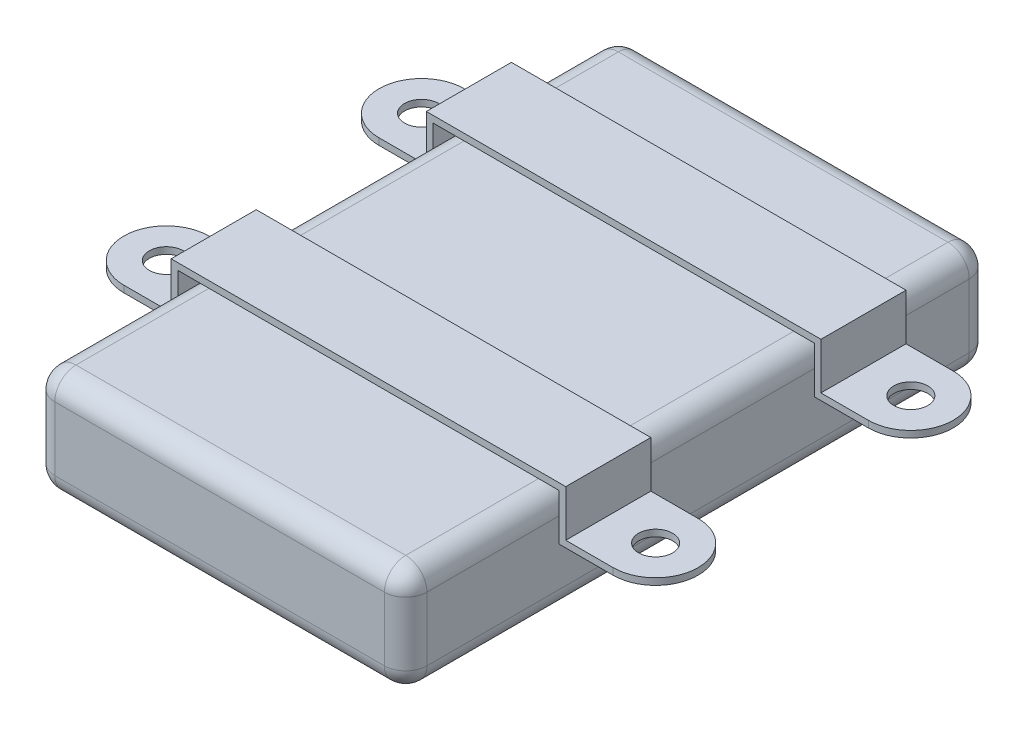
from build123d import *

# Parameters (mm, degrees)
SKETCH1_W      = 69.85
SKETCH1_H      = 12.7
EXTRUDE1_DEPTH = 22.225
FILLET1_R      = 2.54
EXTRUDE2_START = -27.94
EXTRUDE2_DEPTH = 10.16
EXTRUDE3_START = -58.42
EXTRUDE3_DEPTH = 10.16
SKETCH3_R      = 2.032
EXTRUDE4_DEPTH = 18.542


with BuildPart() as part:
    # Sketch1 → Extrude1 (new, symmetric)
    with BuildSketch(Plane(origin=(0, 0, 0), x_dir=(0, 0, -1), z_dir=(1, 0, 0))):
        with Locations((34.925, 6.35)):
            Rectangle(SKETCH1_W, SKETCH1_H)
    extrude(amount=EXTRUDE1_DEPTH, both=True)

    # Fillet1
    fillet1_edges = [part.edges().sort_by_distance(p)[0] for p in [
        (-22.225, 0, -34.925),
        (0, 0, -69.85),
        (-22.225, 6.35, -69.85),
        (22.225, 6.35, -69.85),
        (22.225, 0, -34.925),
        (22.225, 6.35, 0),
        (0, 0, 0),
        (-22.225, 6.35, 0),
        (0, 12.7, -69.85),
        (22.225, 12.7, -34.925),
        (0, 12.7, 0),
        (-22.225, 12.7, -34.925),
    ]]
    fillet(fillet1_edges, radius=FILLET1_R)


with BuildPart() as body_2:
    # Sketch2 → Extrude2 (new body)
    with BuildSketch(Plane.XY.offset(EXTRUDE2_START)):
        Polygon((-34.868909027, 7.784119326), (-22.771071042, 7.784119326), (-22.771071042, 13.333656019), (0, 13.333656019), (22.771071042, 13.333656019), (22.771071042, 7.784119326), (34.868909027, 7.784119326), (34.868909027, 8.577869326), (23.564821042, 8.577869326), (23.564821042, 14.127406019), (0, 14.127406019), (-23.564821042, 14.127406019), (-23.564821042, 8.577869326), (-34.868909027, 8.577869326), align=None)
    extrude(amount=EXTRUDE2_DEPTH)


with BuildPart() as body_3:
    # Sketch2<2> → Extrude3 (new body)
    with BuildSketch(Plane.XY.offset(EXTRUDE3_START)):
        Polygon((-34.868909027, 7.784119326), (-22.771071042, 7.784119326), (-22.771071042, 13.333656019), (0, 13.333656019), (22.771071042, 13.333656019), (22.771071042, 7.784119326), (34.868909027, 7.784119326), (34.868909027, 8.577869326), (23.564821042, 8.577869326), (23.564821042, 14.127406019), (0, 14.127406019), (-23.564821042, 14.127406019), (-23.564821042, 8.577869326), (-34.868909027, 8.577869326), align=None)
    extrude(amount=EXTRUDE3_DEPTH)


with BuildPart() as extrude4_tool:
    # Sketch3 → Extrude4 (new body)
    with BuildSketch(Plane(origin=(0, 0, 0), x_dir=(1, 0, 0), z_dir=(0, 1, 0))):
        with Locations((29.216865034, 53.34)):
            Circle(SKETCH3_R)
        with Locations((29.216865034, 22.86)):
            Circle(SKETCH3_R)
        with Locations((-29.216865034, 22.86)):
            Circle(SKETCH3_R)
        with Locations((-29.216865034, 53.34)):
            Circle(SKETCH3_R)
        with BuildLine():
            Line((-29.216865034, 58.42), (-40.15144848, 58.42))
            Line((-40.15144848, 58.42), (-40.15144848, 48.26))
            Line((-40.15144848, 48.26), (-29.216865034, 48.26))
            ThreePointArc((-29.216865034, 48.26), (-34.296865034, 53.34), (-29.216865034, 58.42))
        make_face()
        with BuildLine():
            Line((-29.216865034, 17.78), (-40.15144848, 17.78))
            Line((-40.15144848, 17.78), (-40.15144848, 27.94))
            Line((-40.15144848, 27.94), (-29.216865034, 27.94))
            ThreePointArc((-29.216865034, 27.94), (-34.296865034, 22.86), (-29.216865034, 17.78))
        make_face()
        with BuildLine():
            Line((40.15144848, 48.26), (29.216865034, 48.26))
            ThreePointArc((29.216865034, 48.26), (34.296865034, 53.34), (29.216865034, 58.42))
            Line((29.216865034, 58.42), (40.15144848, 58.42))
            Line((40.15144848, 58.42), (40.15144848, 48.26))
        make_face()
        with BuildLine():
            Line((40.15144848, 17.78), (40.15144848, 27.94))
            Line((40.15144848, 27.94), (29.216865034, 27.94))
            ThreePointArc((29.216865034, 27.94), (34.296865034, 22.86), (29.216865034, 17.78))
            Line((29.216865034, 17.78), (40.15144848, 17.78))
        make_face()
    extrude(amount=EXTRUDE4_DEPTH)


with BuildPart() as body_2_1:
    add(body_2.part)

    # Extrude4: cut by extrude4_tool
    add(extrude4_tool.part, mode=Mode.SUBTRACT)


with BuildPart() as body_3_1:
    add(body_3.part)

    # Extrude4: cut by extrude4_tool
    add(extrude4_tool.part, mode=Mode.SUBTRACT)


solid = Compound([part.part, body_2_1.part, body_3_1.part])
